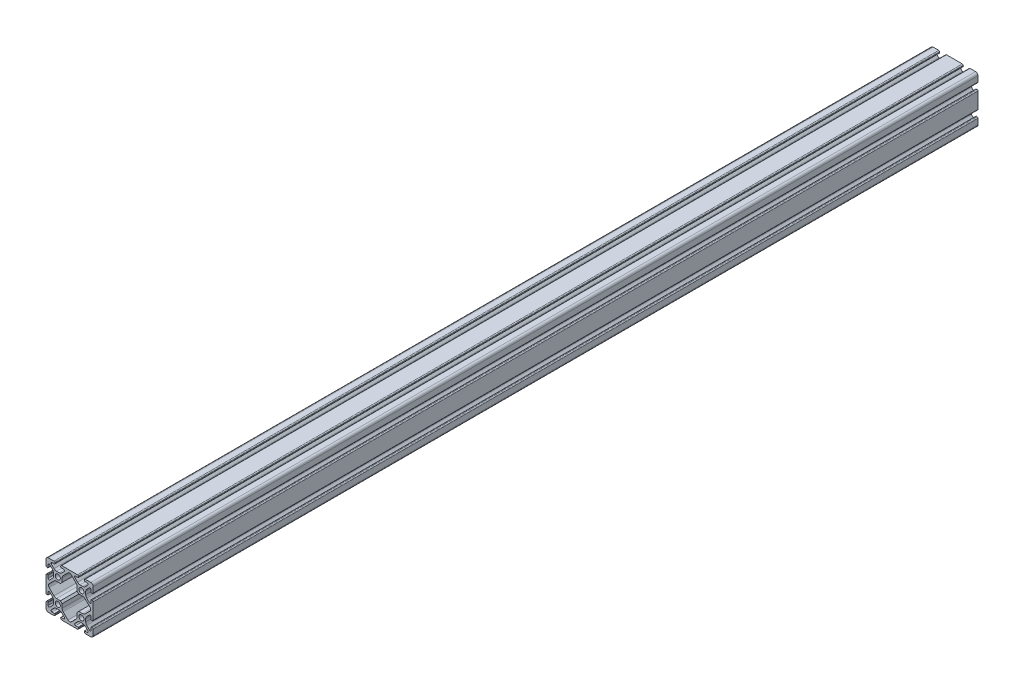
from build123d import *
from OCP.BRepAlgoAPI import BRepAlgoAPI_Cut
from OCP.TopTools import TopTools_ListOfShape

# Parameters (mm, degrees)
SKETCH4_W             = 40
SKETCH4_H             = 40
BODY_DEPTH            = 750
CUT_PROFILE_START     = -375
CUT_PROFILE_OUTLINE_R = 2.15
CUT_PROFILE_DEPTH     = 750


with BuildPart() as part:
    # Sketch4 → Body (new body)
    with BuildSketch(Plane.XY.offset(375)):
        Rectangle(SKETCH4_W, SKETCH4_H)
    extrude(amount=-BODY_DEPTH)


with BuildPart() as cut_profile_tool:
    # Cut-Profile: read off the stored shape, not the designer's step
    # Cut-Profile outline → Cut-Profile (new body)
    with BuildSketch(Plane.XY.offset(CUT_PROFILE_START)):
        with Locations((-9.999999557, 10.000000441)):
            Circle(CUT_PROFILE_OUTLINE_R)
        with Locations((-9.999999557, -9.999999559)):
            Circle(CUT_PROFILE_OUTLINE_R)
        with Locations((10.000000443, -9.999999559)):
            Circle(CUT_PROFILE_OUTLINE_R)
        with Locations((10.000000443, 10.000000441)):
            Circle(CUT_PROFILE_OUTLINE_R)
        with BuildLine():
            Line((13.255887559, -5.471319561), (17.312994561, -1.414212559))
            ThreePointArc((17.312994561, -1.414212559), (17.898780997, 1.124e-06), (17.312994386, 1.414214735))
            Line((17.312994386, 1.414214735), (13.255887299, 5.471320823))
            ThreePointArc((13.255887299, 5.471320823), (12.282617345, 6.121638885), (11.13456722, 6.350000216))
            Line((11.13456722, 6.350000216), (7.79213522, 6.350000216))
            Line((7.79213522, 6.350000216), (6.35000022, 7.792136216))
            Line((6.35000022, 7.792136216), (6.35000022, 11.134567216))
            ThreePointArc((6.35000022, 11.134567216), (6.121638747, 12.282617685), (5.471320301, 13.255887822))
            Line((5.471320301, 13.255887822), (1.414213387, 17.312993733))
            ThreePointArc((1.414213387, 17.312993733), (1e-09, 17.898779994), (-1.414213384, 17.312993732))
            Line((-1.414213384, 17.312993732), (-5.471320297, 13.255887819))
            ThreePointArc((-5.471320297, 13.255887819), (-6.12163874, 12.282617683), (-6.350000213, 11.134567217))
            Line((-6.350000213, 11.134567217), (-6.350000213, 7.792136217))
            Line((-6.350000213, 7.792136217), (-7.792136213, 6.350000217))
            Line((-7.792136213, 6.350000217), (-11.134567213, 6.350000217))
            ThreePointArc((-11.134567213, 6.350000217), (-12.28261751, 6.121638815), (-13.255887557, 5.471320561))
            Line((-13.255887557, 5.471320561), (-17.312993557, 1.414214561))
            ThreePointArc((-17.312993557, 1.414214561), (-17.898779994, 1.124e-06), (-17.312993731, -1.414212385))
            Line((-17.312993731, -1.414212385), (-13.255887818, -5.471319298))
            ThreePointArc((-13.255887818, -5.471319298), (-12.282617682, -6.121637741), (-11.134567216, -6.349999214))
            Line((-11.134567216, -6.349999214), (-7.792136216, -6.349999214))
            Line((-7.792136216, -6.349999214), (-6.350000216, -7.792135214))
            Line((-6.350000216, -7.792135214), (-6.350000216, -11.134566214))
            ThreePointArc((-6.350000216, -11.134566214), (-6.121638814, -12.282616511), (-5.47132056, -13.255886558))
            Line((-5.47132056, -13.255886558), (-1.41421356, -17.312993558))
            ThreePointArc((-1.41421356, -17.312993558), (0, -17.898779994), (1.41421356, -17.312993558))
            Line((1.41421356, -17.312993558), (5.47132056, -13.255886558))
            ThreePointArc((5.47132056, -13.255886558), (6.121638813, -12.282616513), (6.350000215, -11.134566217))
            Line((6.350000215, -11.134566217), (6.350000215, -7.792135217))
            Line((6.350000215, -7.792135217), (7.792135215, -6.349999217))
            Line((7.792135215, -6.349999217), (11.134567215, -6.349999217))
            ThreePointArc((11.134567215, -6.349999217), (12.282617512, -6.121637815), (13.255887559, -5.471319561))
        make_face()
        with BuildLine():
            Line((-18.199999561, 7.20000043), (-18.199999561, 5.08241203))
            ThreePointArc((-18.199999561, 5.08241203), (-17.686138087, 4.313363987), (-16.778984067, 4.49380814))
            Line((-16.778984067, 4.49380814), (-14.528679227, 6.74411298))
            ThreePointArc((-14.528679227, 6.74411298), (-13.878360973, 7.717383026), (-13.649999571, 8.865433323))
            Line((-13.649999571, 8.865433323), (-13.649999571, 11.134567533))
            ThreePointArc((-13.649999571, 11.134567533), (-13.878360973, 12.282617828), (-14.528679226, 13.255887873))
            Line((-14.528679226, 13.255887873), (-16.778984066, 15.506192713))
            ThreePointArc((-16.778984066, 15.506192713), (-17.686138092, 15.686636868), (-18.19999957, 14.917588819))
            Line((-18.19999957, 14.917588819), (-18.19999957, 12.800000419))
            ThreePointArc((-18.19999957, 12.800000419), (-18.287867536, 12.587868385), (-18.49999957, 12.500000419))
            Line((-18.49999957, 12.500000419), (-19.19999957, 12.500000419))
            ThreePointArc((-19.19999957, 12.500000419), (-19.765684995, 12.734314994), (-19.99999957, 13.300000419))
            Line((-19.99999957, 13.300000419), (-19.999999563, 6.70000043))
            ThreePointArc((-19.999999563, 6.70000043), (-19.765684988, 7.265685856), (-19.199999562, 7.500000431))
            Line((-19.199999562, 7.500000431), (-18.499999562, 7.500000431))
            ThreePointArc((-18.499999562, 7.500000431), (-18.287867527, 7.412132465), (-18.199999561, 7.20000043))
        make_face()
        with BuildLine():
            ThreePointArc((-19.199999563, -7.49999957), (-19.765684988, -7.265684995), (-19.999999563, -6.69999957))
            Line((-19.999999563, -6.69999957), (-19.999999557, -13.299999559))
            ThreePointArc((-19.999999557, -13.299999559), (-19.765684982, -12.734314133), (-19.199999556, -12.499999558))
            Line((-19.199999556, -12.499999558), (-18.499999556, -12.499999558))
            ThreePointArc((-18.499999556, -12.499999558), (-18.287867521, -12.587867524), (-18.199999555, -12.799999559))
            Line((-18.199999555, -12.799999559), (-18.199999555, -14.917587959))
            ThreePointArc((-18.199999555, -14.917587959), (-17.68613808, -15.686636002), (-16.778984061, -15.506191849))
            Line((-16.778984061, -15.506191849), (-14.528679221, -13.255887009))
            ThreePointArc((-14.528679221, -13.255887009), (-13.878360967, -12.282616963), (-13.649999564, -11.134566666))
            Line((-13.649999564, -11.134566666), (-13.649999564, -8.865432456))
            ThreePointArc((-13.649999564, -8.865432456), (-13.878360966, -7.717382161), (-14.528679219, -6.744112116))
            Line((-14.528679219, -6.744112116), (-16.778984059, -4.493807276))
            ThreePointArc((-16.778984059, -4.493807276), (-17.686138085, -4.313363121), (-18.199999563, -5.08241117))
            Line((-18.199999563, -5.08241117), (-18.199999563, -7.19999957))
            ThreePointArc((-18.199999563, -7.19999957), (-18.287867529, -7.412131604), (-18.499999563, -7.49999957))
            Line((-18.499999563, -7.49999957), (-19.199999563, -7.49999957))
        make_face()
        with BuildLine():
            Line((-20, 20), (-19.99999957, 18.000000419))
            ThreePointArc((-19.99999957, 18.000000419), (-19.414213132, 19.414213981), (-17.99999957, 20.000000419))
            Line((-17.99999957, 20.000000419), (-20, 20))
        make_face()
        with BuildLine():
            ThreePointArc((-17.999999557, -19.999999559), (-19.414213119, -19.414213121), (-19.999999557, -17.999999559))
            Line((-19.999999557, -17.999999559), (-20, -20))
            Line((-20, -20), (-17.999999557, -19.999999559))
        make_face()
        with BuildLine():
            Line((-6.699999581, 20.000000426), (-13.29999957, 20.000000419))
            ThreePointArc((-13.29999957, 20.000000419), (-12.734314144, 19.765685844), (-12.499999569, 19.200000418))
            Line((-12.499999569, 19.200000418), (-12.499999569, 18.500000418))
            ThreePointArc((-12.499999569, 18.500000418), (-12.587867535, 18.287868383), (-12.79999957, 18.200000417))
            Line((-12.79999957, 18.200000417), (-14.91758797, 18.200000417))
            ThreePointArc((-14.91758797, 18.200000417), (-15.686636013, 17.686138943), (-15.50619186, 16.778984923))
            Line((-15.50619186, 16.778984923), (-13.25588702, 14.528680083))
            ThreePointArc((-13.25588702, 14.528680083), (-12.282616974, 13.878361829), (-11.134566677, 13.650000427))
            Line((-11.134566677, 13.650000427), (-8.865432467, 13.650000427))
            ThreePointArc((-8.865432467, 13.650000427), (-7.717382172, 13.878361829), (-6.744112127, 14.528680082))
            Line((-6.744112127, 14.528680082), (-4.493807287, 16.778984922))
            ThreePointArc((-4.493807287, 16.778984922), (-4.313363132, 17.686138948), (-5.082411181, 18.200000426))
            Line((-5.082411181, 18.200000426), (-7.199999581, 18.200000426))
            ThreePointArc((-7.199999581, 18.200000426), (-7.412131615, 18.287868392), (-7.499999581, 18.500000426))
            Line((-7.499999581, 18.500000426), (-7.499999581, 19.200000426))
            ThreePointArc((-7.499999581, 19.200000426), (-7.265685006, 19.765685851), (-6.699999581, 20.000000426))
        make_face()
        with BuildLine():
            ThreePointArc((-12.499999557, -19.199999559), (-12.734314132, -19.765684984), (-13.299999557, -19.999999559))
            Line((-13.299999557, -19.999999559), (-6.699999568, -19.999999553))
            ThreePointArc((-6.699999568, -19.999999553), (-7.265684994, -19.765684977), (-7.499999569, -19.199999551))
            Line((-7.499999569, -19.199999551), (-7.499999569, -18.499999551))
            ThreePointArc((-7.499999569, -18.499999551), (-7.412131603, -18.287867516), (-7.199999568, -18.19999955))
            Line((-7.199999568, -18.19999955), (-5.082411168, -18.19999955))
            ThreePointArc((-5.082411168, -18.19999955), (-4.313363124, -17.686138076), (-4.493807278, -16.778984056))
            Line((-4.493807278, -16.778984056), (-6.744112118, -14.528679216))
            ThreePointArc((-6.744112118, -14.528679216), (-7.717382164, -13.878360962), (-8.865432461, -13.64999956))
            Line((-8.865432461, -13.64999956), (-11.134566671, -13.64999956))
            ThreePointArc((-11.134566671, -13.64999956), (-12.282616966, -13.878360962), (-13.255887011, -14.528679215))
            Line((-13.255887011, -14.528679215), (-15.506191851, -16.778984055))
            ThreePointArc((-15.506191851, -16.778984055), (-15.686636006, -17.686138081), (-14.917587957, -18.199999559))
            Line((-14.917587957, -18.199999559), (-12.799999557, -18.199999559))
            ThreePointArc((-12.799999557, -18.199999559), (-12.587867523, -18.287867525), (-12.499999557, -18.499999559))
            Line((-12.499999557, -18.499999559), (-12.499999557, -19.199999559))
        make_face()
        with BuildLine():
            Line((13.300000408, 20.000000432), (6.700000419, 20.000000426))
            ThreePointArc((6.700000419, 20.000000426), (7.265685845, 19.76568585), (7.50000042, 19.200000424))
            Line((7.50000042, 19.200000424), (7.50000042, 18.500000424))
            ThreePointArc((7.50000042, 18.500000424), (7.412132454, 18.287868389), (7.200000419, 18.200000423))
            Line((7.200000419, 18.200000423), (5.082412019, 18.200000423))
            ThreePointArc((5.082412019, 18.200000423), (4.313363976, 17.686138949), (4.493808129, 16.778984929))
            Line((4.493808129, 16.778984929), (6.744112969, 14.528680089))
            ThreePointArc((6.744112969, 14.528680089), (7.717383016, 13.878361836), (8.865433312, 13.650000433))
            Line((8.865433312, 13.650000433), (11.134567522, 13.650000433))
            ThreePointArc((11.134567522, 13.650000433), (12.282617817, 13.878361835), (13.255887862, 14.528680088))
            Line((13.255887862, 14.528680088), (15.506192702, 16.778984928))
            ThreePointArc((15.506192702, 16.778984928), (15.686636857, 17.686138954), (14.917588808, 18.200000432))
            Line((14.917588808, 18.200000432), (12.800000408, 18.200000432))
            ThreePointArc((12.800000408, 18.200000432), (12.587868374, 18.287868398), (12.500000408, 18.500000432))
            Line((12.500000408, 18.500000432), (12.500000408, 19.200000432))
            ThreePointArc((12.500000408, 19.200000432), (12.734314983, 19.765685857), (13.300000408, 20.000000432))
        make_face()
        with BuildLine():
            ThreePointArc((7.500000432, -19.199999553), (7.265685856, -19.765684978), (6.700000432, -19.999999553))
            Line((6.700000432, -19.999999553), (13.300000421, -19.999999546))
            ThreePointArc((13.300000421, -19.999999546), (12.734314995, -19.765684971), (12.50000042, -19.199999545))
            Line((12.50000042, -19.199999545), (12.50000042, -18.499999545))
            ThreePointArc((12.50000042, -18.499999545), (12.587868386, -18.28786751), (12.800000421, -18.199999544))
            Line((12.800000421, -18.199999544), (14.917588821, -18.199999544))
            ThreePointArc((14.917588821, -18.199999544), (15.686636865, -17.68613807), (15.506192711, -16.77898405))
            Line((15.506192711, -16.77898405), (13.255887871, -14.52867921))
            ThreePointArc((13.255887871, -14.52867921), (12.282617825, -13.878360956), (11.134567528, -13.649999553))
            Line((11.134567528, -13.649999553), (8.865433318, -13.649999553))
            ThreePointArc((8.865433318, -13.649999553), (7.717383023, -13.878360955), (6.744112978, -14.528679208))
            Line((6.744112978, -14.528679208), (4.493808138, -16.778984048))
            ThreePointArc((4.493808138, -16.778984048), (4.313363983, -17.686138075), (5.082412032, -18.199999553))
            Line((5.082412032, -18.199999553), (7.200000432, -18.199999553))
            ThreePointArc((7.200000432, -18.199999553), (7.412132467, -18.287867518), (7.500000432, -18.499999553))
            Line((7.500000432, -18.499999553), (7.500000432, -19.199999553))
        make_face()
        with BuildLine():
            Line((20, 20), (18.000000408, 20.000000432))
            ThreePointArc((18.000000408, 20.000000432), (19.414213971, 19.414213995), (20.000000408, 18.000000432))
            Line((20.000000408, 18.000000432), (20, 20))
        make_face()
        with BuildLine():
            ThreePointArc((20.000000421, -17.999999546), (19.414213983, -19.414213109), (18.000000421, -19.999999546))
            Line((18.000000421, -19.999999546), (20, -20))
            Line((20, -20), (20.000000421, -17.999999546))
        make_face()
        with BuildLine():
            Line((20.000000415, 6.700000443), (20.000000408, 13.300000432))
            ThreePointArc((20.000000408, 13.300000432), (19.765685833, 12.734315006), (19.200000407, 12.500000431))
            Line((19.200000407, 12.500000431), (18.500000407, 12.500000431))
            ThreePointArc((18.500000407, 12.500000431), (18.287868372, 12.587868397), (18.200000406, 12.800000432))
            Line((18.200000406, 12.800000432), (18.200000406, 14.917588832))
            ThreePointArc((18.200000406, 14.917588832), (17.686138932, 15.686636876), (16.778984912, 15.506192722))
            Line((16.778984912, 15.506192722), (14.528680072, 13.255887882))
            ThreePointArc((14.528680072, 13.255887882), (13.878361818, 12.282617836), (13.650000416, 11.134567539))
            Line((13.650000416, 11.134567539), (13.650000416, 8.865433329))
            ThreePointArc((13.650000416, 8.865433329), (13.878361818, 7.717383034), (14.528680071, 6.744112989))
            Line((14.528680071, 6.744112989), (16.778984911, 4.493808149))
            ThreePointArc((16.778984911, 4.493808149), (17.686138937, 4.313363994), (18.200000415, 5.082412043))
            Line((18.200000415, 5.082412043), (18.200000415, 7.200000443))
            ThreePointArc((18.200000415, 7.200000443), (18.287868381, 7.412132478), (18.500000415, 7.500000443))
            Line((18.500000415, 7.500000443), (19.200000415, 7.500000443))
            ThreePointArc((19.200000415, 7.500000443), (19.76568584, 7.265685868), (20.000000415, 6.700000443))
        make_face()
        with BuildLine():
            ThreePointArc((19.200000421, -12.499999546), (19.765685846, -12.734314121), (20.000000421, -13.299999546))
            Line((20.000000421, -13.299999546), (20.000000415, -6.699999557))
            ThreePointArc((20.000000415, -6.699999557), (19.765685839, -7.265684983), (19.200000413, -7.499999558))
            Line((19.200000413, -7.499999558), (18.500000413, -7.499999558))
            ThreePointArc((18.500000413, -7.499999558), (18.287868378, -7.412131592), (18.200000412, -7.199999557))
            Line((18.200000412, -7.199999557), (18.200000412, -5.082411157))
            ThreePointArc((18.200000412, -5.082411157), (17.686138938, -4.313363114), (16.778984918, -4.493807267))
            Line((16.778984918, -4.493807267), (14.528680078, -6.744112107))
            ThreePointArc((14.528680078, -6.744112107), (13.878361825, -7.717382153), (13.650000422, -8.86543245))
            Line((13.650000422, -8.86543245), (13.650000422, -11.13456666))
            ThreePointArc((13.650000422, -11.13456666), (13.878361824, -12.282616955), (14.528680077, -13.255887))
            Line((14.528680077, -13.255887), (16.778984917, -15.50619184))
            ThreePointArc((16.778984917, -15.50619184), (17.686138943, -15.686635995), (18.200000421, -14.917587946))
            Line((18.200000421, -14.917587946), (18.200000421, -12.799999546))
            ThreePointArc((18.200000421, -12.799999546), (18.287868387, -12.587867512), (18.500000421, -12.499999546))
            Line((18.500000421, -12.499999546), (19.200000421, -12.499999546))
        make_face()
    extrude(amount=CUT_PROFILE_DEPTH)


with BuildPart() as part_1:
    add(part.part)

    # Cut-Profile: cut by cut_profile_tool, with a tolerance
    cut_profile_stock = TopTools_ListOfShape()
    cut_profile_stock.Append(part_1.part.wrapped)
    cut_profile_tools = TopTools_ListOfShape()
    cut_profile_tools.Append(cut_profile_tool.part.wrapped)
    cut_profile_cut = BRepAlgoAPI_Cut()
    cut_profile_cut.SetArguments(cut_profile_stock)
    cut_profile_cut.SetTools(cut_profile_tools)
    cut_profile_cut.SetFuzzyValue(0.00001)
    cut_profile_cut.Build()
    add(Compound.cast(cut_profile_cut.Shape()).solids(), mode=Mode.REPLACE)


solid = part_1.part
